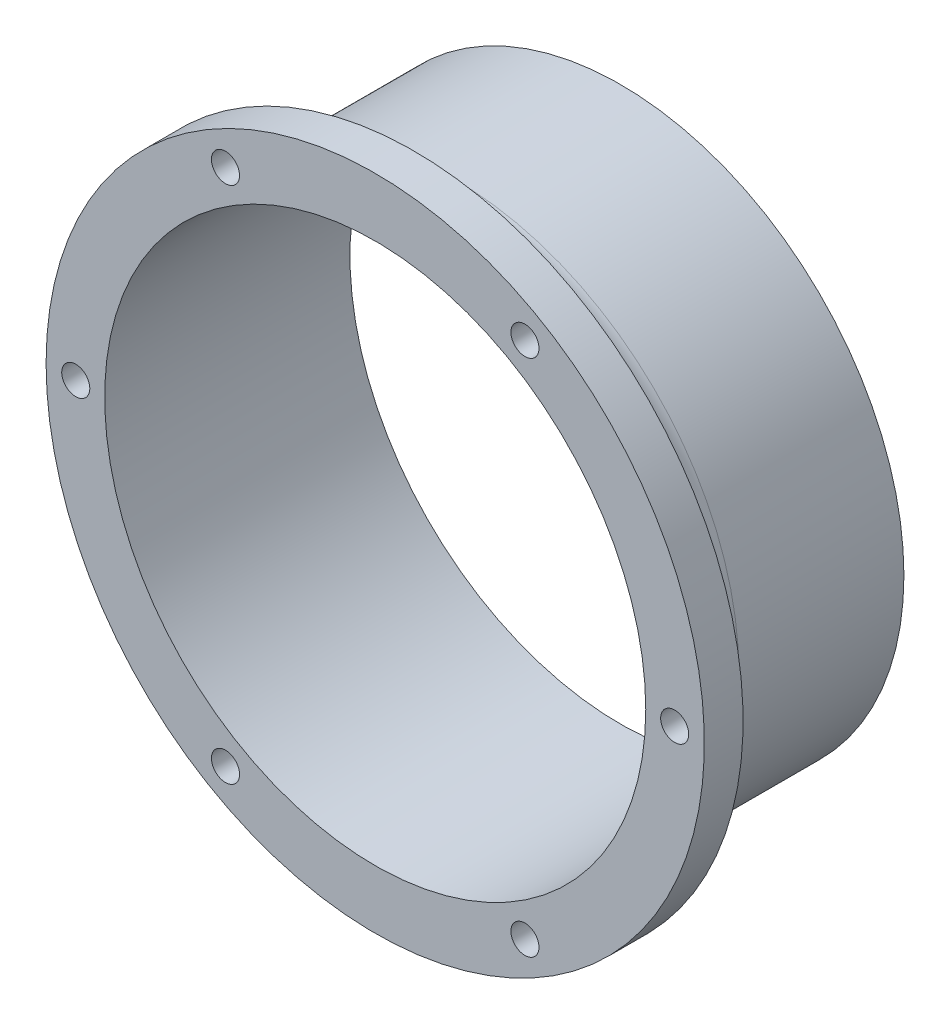
from build123d import *

# Parameters (mm, degrees)
SKETCH1_R           = 34.8615
SKETCH1_R_2         = 33.274
BOSS_EXTRUDE1_DEPTH = 25.4
SKETCH2_R           = 40.48125
SKETCH2_R_2         = 33.274
BOSS_EXTRUDE2_DEPTH = 4.7625
FILLET1_R           = 5.08
CIRPATTERN1_COUNT   = 6


with BuildPart() as part:
    # Sketch1 → Boss-Extrude1 (new body)
    with BuildSketch(Plane.XY):
        Circle(SKETCH1_R)
        Circle(SKETCH1_R_2, mode=Mode.SUBTRACT)
    extrude(amount=BOSS_EXTRUDE1_DEPTH)

    # Sketch2 → Boss-Extrude2 (add)
    with BuildSketch(Plane.XY.offset(25.4)):
        Circle(SKETCH2_R)
        Circle(SKETCH2_R_2, mode=Mode.SUBTRACT)
    extrude(amount=BOSS_EXTRUDE2_DEPTH)

    # Fillet1
    fillet1_edges = [part.edges().sort_by_distance(p)[0] for p in [
        (-34.8615, 0, 25.4),
    ]]
    fillet(fillet1_edges, radius=FILLET1_R)

    # Sketch7 → #8-32 Tapped Hole1 (revolve, cut)
    with BuildSketch(Plane(origin=(-18.415, 31.895715621, 30.1625), x_dir=(0, -1, 0), z_dir=(1, 0, 0))):
        Polygon((0, 0), (0, 11.705806461), (1.7272, 10.668), (1.7272, 0), align=None)
    f_8_32_tapped_hole1 = revolve(axis=Axis((-18.415, 31.895715621, 36.5125), (0, 0, -1)), mode=Mode.SUBTRACT)

    # CirPattern1: #8-32 Tapped Hole1 ×6 about axis
    cirpattern1_axis = Axis((0, 0, 30.1625), (0, 0, 1))
    for i in range(1, CIRPATTERN1_COUNT):
        add(f_8_32_tapped_hole1.rotate(cirpattern1_axis, i * 360 / CIRPATTERN1_COUNT), mode=Mode.SUBTRACT)


solid = part.part
